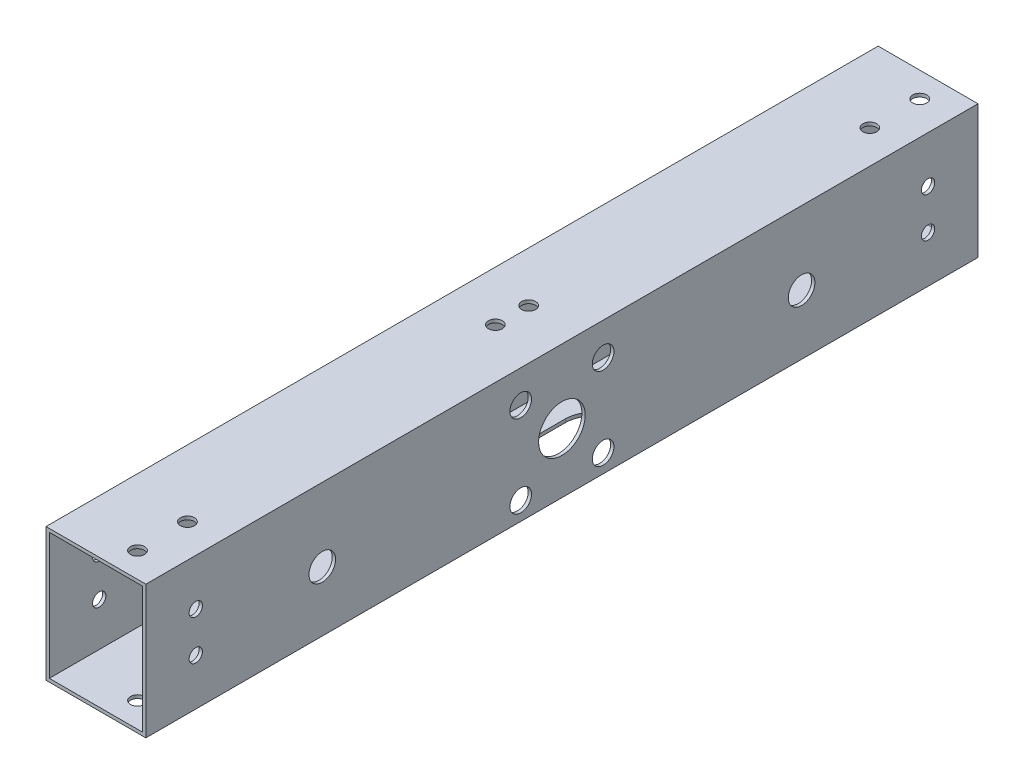
from build123d import *

# Parameters (mm, degrees)
SKETCH_1_W          = 30
SKETCH_1_H          = 40
SKETCH_1_W_2        = 28
SKETCH_1_H_2        = 38
EXTRUDE_1_DEPTH     = 250
SKETCH_3_R          = 2.1
CUT_EXTRUDE_1_DEPTH = 250
SKETCH_4_R          = 4
CUT_EXTRUDE_2_DEPTH = 250
SKETCH_5_R          = 7
CUT_EXTRUDE_3_DEPTH = 250
CUT_EXTRUDE_4_DEPTH = 20
CUT_EXTRUDE_START   = -20
SKETCH_8_R          = 3.25
CUT_EXTRUDE_7_DEPTH = 22
SKETCH_9_R          = 2
CUT_EXTRUDE_8_DEPTH = 36


with BuildPart() as part:
    # 草图1 → 凸台-拉伸1 (new body)
    with BuildSketch(Plane.XY):
        Rectangle(SKETCH_1_W, SKETCH_1_H)
        Rectangle(SKETCH_1_W_2, SKETCH_1_H_2, mode=Mode.SUBTRACT)
    extrude(amount=EXTRUDE_1_DEPTH)

    # 草图3 → 切除-拉伸1 (cut)
    with BuildSketch(Plane(origin=(0, 20, 0), x_dir=(1, 0, 0), z_dir=(0, 1, 0))):
        with Locations((5, -7.5)):
            Circle(SKETCH_3_R)
        with Locations((5, -22.5)):
            Circle(SKETCH_3_R)
        with Locations((5, -227.5)):
            Circle(SKETCH_3_R)
        with Locations((5, -242.5)):
            Circle(SKETCH_3_R)
        with Locations((0, -120)):
            Circle(SKETCH_3_R)
        with Locations((0, -130)):
            Circle(SKETCH_3_R)
    extrude(amount=-CUT_EXTRUDE_1_DEPTH, mode=Mode.SUBTRACT)

    # 草图4 → 切除-拉伸2 (cut)
    with BuildSketch(Plane(origin=(15, 0, 0), x_dir=(0, 0, -1), z_dir=(1, 0, 0))):
        with Locations((-53, -2)):
            Circle(SKETCH_4_R)
        with Locations((-197, -2)):
            Circle(SKETCH_4_R)
    extrude(amount=-CUT_EXTRUDE_2_DEPTH, mode=Mode.SUBTRACT)

    # 草图5 → 切除-拉伸3 (cut)
    with BuildSketch(Plane.ZY.offset(15)):
        with Locations((125, -2)):
            Circle(SKETCH_5_R)
    extrude(amount=-CUT_EXTRUDE_3_DEPTH, mode=Mode.SUBTRACT)

    # 草图6 → 切除-拉伸4 (cut)
    with BuildSketch(Plane.XZ.offset(20)):
        with BuildLine():
            Line((-4, 145), (-4, 105))
            ThreePointArc((-4, 105), (4.5, 96.5), (13, 105))
            Line((13, 105), (13, 145))
            ThreePointArc((13, 145), (4.5, 153.5), (-4, 145))
        make_face()
    extrude(amount=-CUT_EXTRUDE_4_DEPTH, mode=Mode.SUBTRACT)

    # 草图8 → 切除-拉伸7 (cut)
    with BuildSketch(Plane.ZY.offset(15).offset(CUT_EXTRUDE_START)):
        with Locations((112.625, -14.5)):
            Circle(SKETCH_8_R)
        with Locations((137.375, -14.5)):
            Circle(SKETCH_8_R)
        with Locations((112.625, 10.25)):
            Circle(SKETCH_8_R)
        with Locations((137.375, 10.25)):
            Circle(SKETCH_8_R)
    extrude(amount=-CUT_EXTRUDE_7_DEPTH, mode=Mode.SUBTRACT)

    # 草图9 → 切除-拉伸8 (cut)
    with BuildSketch(Plane(origin=(15, 0, 0), x_dir=(0, 0, -1), z_dir=(1, 0, 0))):
        with Locations((-15, 6)):
            Circle(SKETCH_9_R)
        with Locations((-15, -6)):
            Circle(SKETCH_9_R)
        with Locations((-235, -6)):
            Circle(SKETCH_9_R)
        with Locations((-235, 6)):
            Circle(SKETCH_9_R)
    extrude(amount=-CUT_EXTRUDE_8_DEPTH, mode=Mode.SUBTRACT)


solid = part.part
